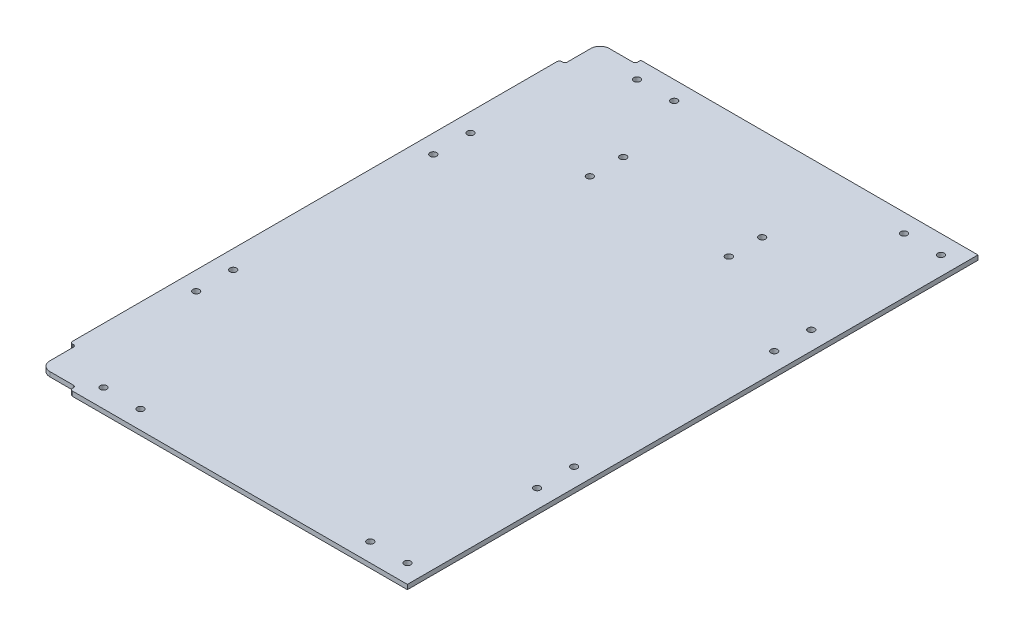
from build123d import *

# Parameters (mm, degrees)
SKETCH1_W             = 259.08
SKETCH1_H             = 391.16
BOSS_EXTRUDE1_DEPTH   = 3.175
F_8_CLEARANCE_HOLE1_D = 4.4958
F_8_CLEARANCE_HOLE2_D = 4.4958
SKETCH25_W            = 3.81
SKETCH25_H            = 24.13
SKETCH25_H_2          = 3.81
SKETCH25_W_2          = 24.13
CUT_EXTRUDE1_DEPTH    = 470.18937821
FILLET2_R             = 1.5875
FILLET3_R             = 6.35
MIRROR1_DEPTH         = 3.175


# Read off the part's stored shape, not the designer's step: Mirror1
with BuildPart() as part:
    # Sketch1 → Boss-Extrude1 (new body)
    with BuildSketch(Plane(origin=(0, 0, 0), x_dir=(1, 0, 0), z_dir=(0, 1, 0))):
        with Locations((-129.54, -195.58)):
            Rectangle(SKETCH1_W, SKETCH1_H)
    extrude(amount=BOSS_EXTRUDE1_DEPTH)

    # #8 Clearance Hole1 (through all)
    with Locations(Plane(origin=(0, 0, 0), x_dir=(-1, 0, 0), z_dir=(0, -1, 0))):
        with Locations((84.455, -63.5), (84.455, -86.36), (179.705, -86.36), (179.705, -63.5)):
            Hole(F_8_CLEARANCE_HOLE1_D / 2)

    # #8 Clearance Hole2 (through all)
    with Locations(Plane(origin=(0, 0, 0), x_dir=(-1, 0, 0), z_dir=(0, -1, 0))):
        with Locations((12.7, -101.6), (220.98, -12.7), (246.38, -101.6), (246.38, -289.56), (195.58, -12.7), (12.7, -289.56), (246.38, -264.16), (246.38, -127), (12.7, -127), (12.7, -264.16), (12.7, -378.46), (220.98, -378.46), (38.1, -12.7), (12.7, -12.7), (38.1, -378.46), (195.58, -378.46)):
            Hole(F_8_CLEARANCE_HOLE2_D / 2)

    # Sketch25 → Cut-Extrude1 (cut, through all)
    with BuildSketch(Plane.XZ):
        with Locations((-257.175, 375.285)):
            Rectangle(SKETCH25_W, SKETCH25_H)
        with Locations((-257.175, 389.255)):
            Rectangle(SKETCH25_W, SKETCH25_H_2)
        with Locations((-243.205, 389.255)):
            Rectangle(SKETCH25_W_2, SKETCH25_H_2)
    extrude(amount=-CUT_EXTRUDE1_DEPTH, mode=Mode.SUBTRACT)

    # Fillet2
    fillet2_edges = [part.edges().sort_by_distance(p)[0] for p in [
        (-255.27, 1.5875, 363.22),
        (-259.08, 1.5875, 363.22),
        (-231.14, 1.5875, 391.16),
        (-231.14, 1.5875, 387.35),
    ]]
    fillet(fillet2_edges, radius=FILLET2_R)

    # Fillet3
    fillet3_edges = [part.edges().sort_by_distance(p)[0] for p in [
        (-255.27, 1.5875, 387.35),
    ]]
    fillet(fillet3_edges, radius=FILLET3_R)

    # Mirror1 outline → Mirror1 (cut)
    with BuildSketch(Plane(origin=(0, 0, 0), x_dir=(1, 0, 0), z_dir=(0, 1, 0))):
        with BuildLine():
            ThreePointArc((-256.8575, -27.94), (-255.734967985, -27.475032015), (-255.27, -26.3525))
            Line((-255.27, -26.3525), (-255.27, -10.16))
            ThreePointArc((-255.27, -10.16), (-253.410128061, -5.669871939), (-248.92, -3.81))
            Line((-248.92, -3.81), (-232.7275, -3.81))
            ThreePointArc((-232.7275, -3.81), (-231.604967985, -3.345032015), (-231.14, -2.2225))
            Line((-231.14, -2.2225), (-231.14, 0))
            Line((-231.14, 0), (-259.08, 0))
            Line((-259.08, 0), (-259.08, -29.5275))
            ThreePointArc((-259.08, -29.5275), (-258.615032015, -28.404967985), (-257.4925, -27.94))
            Line((-257.4925, -27.94), (-256.8575, -27.94))
        make_face()
    extrude(amount=MIRROR1_DEPTH, mode=Mode.SUBTRACT)


solid = part.part
